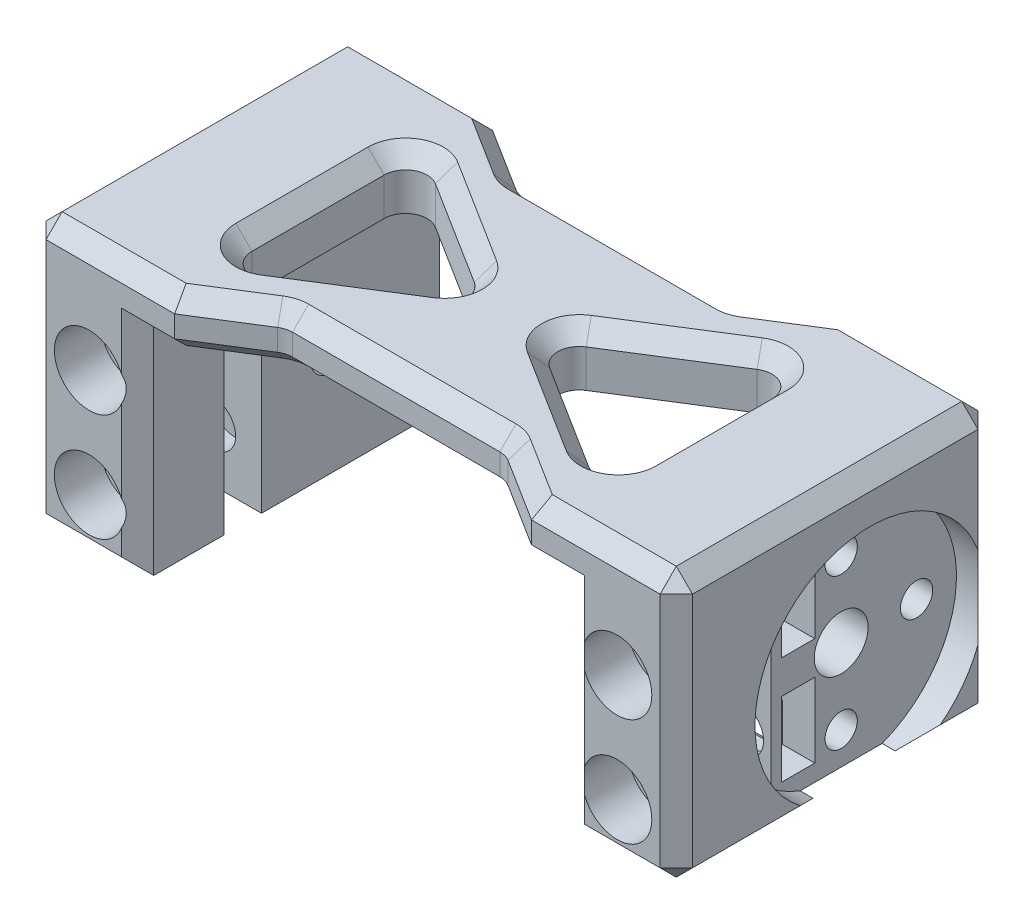
from build123d import *

# Parameters (mm, degrees)
SKETCH1_W           = 10
SKETCH1_H           = 20
SKETCH1_R           = 2.1
BOSS_EXTRUDE1_DEPTH = 8
BOSS_EXTRUDE2_DEPTH = 3.5
BOSS_EXTRUDE3_DEPTH = 18
SKETCH7_R           = 1.5
SKETCH7_R_2         = 2.5
CUT_EXTRUDE1_DEPTH  = 10
SKETCH8_W           = 3.1
SKETCH8_H           = 6.9
CUT_EXTRUDE3_DEPTH  = 13
CUT_EXTRUDE4_START  = -10
SKETCH13_R          = 3.225
CUT_EXTRUDE4_DEPTH  = 4.3
SKETCH14_R          = 4
BOSS_EXTRUDE4_DEPTH = 5
SKETCH15_R          = 6
BOSS_EXTRUDE5_DEPTH = 1
SKETCH16_R          = 3.225
CUT_EXTRUDE5_DEPTH  = 4.3
SKETCH18_R          = 1.95
CUT_EXTRUDE7_DEPTH  = 15
SKETCH19_R          = 2.1
CUT_EXTRUDE8_DEPTH  = 2
SKETCH20_R          = 10.7
CUT_EXTRUDE9_DEPTH  = 2.7
CUT_EXTRUDE10_DEPTH = 53.156015952


with BuildPart() as part:
    # Sketch1 → Boss-Extrude1 (new body)
    # profile 1 of 3: a face of its own
    with BuildSketch(Plane.XY):
        with Locations((25, 0)):
            Rectangle(SKETCH1_W, SKETCH1_H)
        with Locations((24.5, -5)):
            Circle(SKETCH1_R, mode=Mode.SUBTRACT)
        with Locations((24.5, 5)):
            Circle(SKETCH1_R, mode=Mode.SUBTRACT)
    # profile 2 of 3: a face of its own
    with BuildSketch(Plane.XY):
        Polygon((20, 10), (30, 10), (30, 15), (-30, 15), (-30, 10), (-20, 10), align=None)
    # profile 3 of 3: a face of its own
    with BuildSketch(Plane.XY):
        with Locations((-25, 0)):
            Rectangle(SKETCH1_W, SKETCH1_H)
        with Locations((-24.5, -5)):
            Circle(SKETCH1_R, mode=Mode.SUBTRACT)
        with Locations((-24.5, 5)):
            Circle(SKETCH1_R, mode=Mode.SUBTRACT)
    extrude(amount=-BOSS_EXTRUDE1_DEPTH)

    # Sketch5 → Boss-Extrude2 (add)
    with BuildSketch(Plane(origin=(0, 0, -8), x_dir=(-1, 0, 0), z_dir=(0, 0, -1))):
        Polygon((27.75, -10), (27.75, 10), (-27.75, 10), (-27.75, -10), (-30, -10), (-30, 15), (30, 15), (30, -10), align=None)
    extrude(amount=BOSS_EXTRUDE2_DEPTH)

    # Sketch6 → Boss-Extrude3 (add)
    with BuildSketch(Plane(origin=(0, 0, -11.5), x_dir=(-1, 0, 0), z_dir=(0, 0, -1))):
        Polygon((-27.75, -10), (-20, -10), (-20, 10), (20, 10), (20, -10), (27.75, -10), (30, -10), (30, 15), (-30, 15), (-30, -10), align=None)
    extrude(amount=BOSS_EXTRUDE3_DEPTH)

    # Sketch7 → Cut-Extrude1 (cut)
    with BuildSketch(Plane(origin=(30, 0, 0), x_dir=(0, 0, -1), z_dir=(1, 0, 0))):
        with Locations((25, 0)):
            Circle(SKETCH7_R)
        with Locations((18, 7)):
            Circle(SKETCH7_R)
        with Locations((18, -7)):
            Circle(SKETCH7_R)
        with Locations((18, 0)):
            Circle(SKETCH7_R_2)
    extrude(amount=-CUT_EXTRUDE1_DEPTH, mode=Mode.SUBTRACT)

    # Sketch8 → Cut-Extrude3 (cut)
    with BuildSketch(Plane(origin=(30, 0, 0), x_dir=(0, 0, -1), z_dir=(1, 0, 0))):
        with Locations((14, 5)):
            Rectangle(SKETCH8_W, SKETCH8_H)
        with Locations((14, -5)):
            Rectangle(SKETCH8_W, SKETCH8_H)
    extrude(amount=-CUT_EXTRUDE3_DEPTH, mode=Mode.SUBTRACT)

    # Sketch13 → Cut-Extrude4 (cut)
    with BuildSketch(Plane(origin=(30, 0, 0), x_dir=(0, 0, -1), z_dir=(1, 0, 0)).offset(CUT_EXTRUDE4_START)):
        with Locations((18, 7)):
            Circle(SKETCH13_R)
        with Locations(Location((25, 0, 0), (0, 0, 180))):
            Circle(SKETCH13_R)
        with Locations((18, -7)):
            Circle(SKETCH13_R)
    extrude(amount=CUT_EXTRUDE4_DEPTH, mode=Mode.SUBTRACT)

    # Sketch14 → Boss-Extrude4 (add)
    with BuildSketch(Plane.ZY.offset(30)):
        with Locations(Location((-18, 0, 0), (0, 0, 180))):
            Circle(SKETCH14_R)
    extrude(amount=BOSS_EXTRUDE4_DEPTH)

    # Sketch15 → Boss-Extrude5 (add)
    with BuildSketch(Plane.ZY.offset(30)):
        with Locations(Location((-18, 0, 0), (0, 0, 180))):
            Circle(SKETCH15_R)
    extrude(amount=BOSS_EXTRUDE5_DEPTH)

    # Sketch16 → Cut-Extrude5 (cut)
    with BuildSketch(Plane.XY):
        with Locations((-24.5, 5)):
            Circle(SKETCH16_R)
        with Locations((24.5, 5)):
            Circle(SKETCH16_R)
        with Locations((24.5, -5)):
            Circle(SKETCH16_R)
        with Locations((-24.5, -5)):
            Circle(SKETCH16_R)
    extrude(amount=-CUT_EXTRUDE5_DEPTH, mode=Mode.SUBTRACT)

    # Sketch18 → Cut-Extrude7 (cut)
    with BuildSketch(Plane.ZY.offset(35)):
        with Locations((-18, 0)):
            Circle(SKETCH18_R)
    extrude(amount=-CUT_EXTRUDE7_DEPTH, mode=Mode.SUBTRACT)

    # Sketch19 → Cut-Extrude8 (cut)
    with BuildSketch(Plane.XY.offset(-11.5)):
        with Locations((24.5, 5)):
            Circle(SKETCH19_R)
        with Locations((24.5, -5)):
            Circle(SKETCH19_R)
        with Locations((-24.5, -5)):
            Circle(SKETCH19_R)
        with Locations((-24.5, 5)):
            Circle(SKETCH19_R)
    extrude(amount=-CUT_EXTRUDE8_DEPTH, mode=Mode.SUBTRACT)

    # Sketch20 → Cut-Extrude9 (cut)
    with BuildSketch(Plane(origin=(30, 0, 0), x_dir=(0, 0, -1), z_dir=(1, 0, 0))):
        with Locations((18, 0)):
            Circle(SKETCH20_R)
    extrude(amount=-CUT_EXTRUDE9_DEPTH, mode=Mode.SUBTRACT)

    # Sketch21 → Cut-Extrude10 (cut, through all)
    with BuildSketch(Plane(origin=(0, 15, 0), x_dir=(1, 0, 0), z_dir=(0, 1, 0))):
        with BuildLine():
            Line((9.622484047, 25.5), (-9.622484047, 25.5))
            ThreePointArc((-9.622484047, 25.5), (-10.176630683, 25.578302442), (-10.687386285, 25.807078494))
            Line((-10.687386285, 25.807078494), (-16.558184576, 29.5))
            Line((-16.558184576, 29.5), (16.558184576, 29.5))
            Line((16.558184576, 29.5), (10.687386285, 25.807078494))
            ThreePointArc((10.687386285, 25.807078494), (10.176630683, 25.578302442), (9.622484047, 25.5))
        make_face()
        with BuildLine():
            Line((-5.191311112, 16.442921506), (-14.935097763, 22.572077625))
            ThreePointArc((-14.935097763, 22.572077625), (-16.967004531, 22.629842338), (-18, 20.879156119))
            Line((-18, 20.879156119), (-18, 8.620843881))
            ThreePointArc((-18, 8.620843881), (-16.967004531, 6.870157662), (-14.935097763, 6.927922375))
            Line((-14.935097763, 6.927922375), (-5.191311112, 13.057078494))
            ThreePointArc((-5.191311112, 13.057078494), (-4.256213349, 14.75), (-5.191311112, 16.442921506))
        make_face()
        with BuildLine():
            Line((-10.687386285, 3.692921506), (-16.558184576, 0))
            Line((-16.558184576, 0), (16.558184576, 0))
            Line((16.558184576, 0), (10.687386285, 3.692921506))
            ThreePointArc((10.687386285, 3.692921506), (10.176630683, 3.921697558), (9.622484047, 4))
            Line((9.622484047, 4), (-9.622484047, 4))
            ThreePointArc((-9.622484047, 4), (-10.176630683, 3.921697558), (-10.687386285, 3.692921506))
        make_face()
        with BuildLine():
            Line((14.935097763, 6.927922375), (5.191311112, 13.057078494))
            ThreePointArc((5.191311112, 13.057078494), (4.256213349, 14.75), (5.191311112, 16.442921506))
            Line((5.191311112, 16.442921506), (14.935097763, 22.572077625))
            ThreePointArc((14.935097763, 22.572077625), (16.967004531, 22.629842338), (18, 20.879156119))
            Line((18, 20.879156119), (18, 8.620843881))
            ThreePointArc((18, 8.620843881), (16.967004531, 6.870157662), (14.935097763, 6.927922375))
        make_face()
    extrude(amount=-CUT_EXTRUDE10_DEPTH, mode=Mode.SUBTRACT)

    # Chamfer1
    # the kernel refuses this chamfer: 1.5 mm, written as the material it takes off along each edge
    with BuildSketch(Plane(origin=(-29, -9, -1), x_dir=(0.7071067811865483, -0.7071067811865467, 0), z_dir=(-0.5773502691896244, -0.5773502691896257, 0.5773502691896271)), Plane(origin=(-29, 14, -1), x_dir=(0.7071067811865483, 0, 0.7071067811865467), z_dir=(-0.5773502691896253, 0.5773502691896253, 0.5773502691896266)), Plane(origin=(-29, 14, -28.5), x_dir=(0.7071067811865476, 0.7071067811865476, 0), z_dir=(-0.5773502691896257, 0.5773502691896257, -0.5773502691896257)), Plane(origin=(29, 14, -28.5), x_dir=(0, 0.7071067811865476, 0.7071067811865476), z_dir=(0.5773502691896253, 0.577350269189626, -0.577350269189626))) as chamfer1_piece_1:
        Polygon((-1.060660172, -0.612372436), (1.060660172, -0.612372436), (0, 1.224744871), align=None)
    extrude(amount=1.905255888, mode=Mode.SUBTRACT)
    with BuildSketch(Plane(origin=(29, -9, -1), x_dir=(0, 0.7071067811865476, 0.7071067811865476), z_dir=(0.5773502691896257, -0.5773502691896257, 0.5773502691896257)), Plane(origin=(29, 14, -1), x_dir=(0, 0.7071067811865476, -0.7071067811865476), z_dir=(0.5773502691896253, 0.577350269189626, 0.577350269189626)), Plane(origin=(-29, -9, -28.5), x_dir=(0.7071067811865483, -0.7071067811865467, 0), z_dir=(-0.5773502691896246, -0.5773502691896261, -0.5773502691896267)), Plane(origin=(29, -9, -28.5), x_dir=(0, -0.707106781186548, 0.7071067811865471), z_dir=(0.5773502691896255, -0.5773502691896255, -0.5773502691896263))) as chamfer1_piece_2:
        Polygon((-1.060660172, 0.612372436), (1.060660172, 0.612372436), (0, -1.224744871), align=None)
    extrude(amount=1.905255888, mode=Mode.SUBTRACT)
    with BuildSketch(Plane(origin=(20, 10, 0), x_dir=(0, -0.027495876610586778, -0.9996219169112968), z_dir=(-1, 0, 0)), Plane(origin=(-12.700660094, 10, 0), x_dir=(0, -0.027495876610586778, -0.9996219169112968), z_dir=(-1, 0, 0))) as chamfer1_piece_3:
        with BuildLine():
            Line((1.543009793, 0), (-0.084820732, -1.54067669))
            Line((-0.084820732, -1.54067669), (-0.11480939, -1.539851814))
            ThreePointArc((-0.11480939, -1.539851814), (-0.051193841, -0.770096744), (-0.029988658, 0.000824876))
            Line((-0.029988658, 0.000824876), (0.000824876, 0.029988658))
            ThreePointArc((0.000824876, 0.029988658), (0.771746497, 0.008783474), (1.543834669, 0.029988658))
            Line((1.543834669, 0.029988658), (1.543009793, 0))
        make_face()
    extrude(amount=7.299339906, mode=Mode.SUBTRACT)
    with BuildSketch(Plane(origin=(-20, -13.857524482, 0), x_dir=(0.027495876610586778, 0, -0.9996219169112968), z_dir=(0, 1, 0)), Plane(origin=(20, 10, 0), x_dir=(-0.027495876610586778, 0, -0.9996219169112968), z_dir=(0, -1, 0)), Plane(origin=(20, -13.857524482, -29.5), x_dir=(-0.027495876610586768, 0, 0.9996219169112968), z_dir=(0, 1, 0))) as chamfer1_piece_4:
        with BuildLine():
            Line((1.543009793, 0), (-0.084820732, 1.54067669))
            Line((-0.084820732, 1.54067669), (-0.11480939, 1.539851814))
            ThreePointArc((-0.11480939, 1.539851814), (-0.051193841, 0.770096744), (-0.029988658, -0.000824876))
            Line((-0.029988658, -0.000824876), (0.000824876, -0.029988658))
            ThreePointArc((0.000824876, -0.029988658), (0.771746497, -0.008783474), (1.543834669, -0.029988658))
            Line((1.543834669, -0.029988658), (1.543009793, 0))
        make_face()
    extrude(amount=23.857524482, mode=Mode.SUBTRACT)
    with BuildSketch(Plane(origin=(-33.857524482, -10, 0), x_dir=(0, 0.9996219169112968, 0.02749587661058636), z_dir=(1, 0, 0)), Plane(origin=(16.142475518, -10, -29.5), x_dir=(0, -0.027495876610586768, 0.9996219169112968), z_dir=(1, 0, 0))) as chamfer1_piece_5:
        with BuildLine():
            Line((1.543009793, 0), (-0.084820732, -1.54067669))
            Line((-0.084820732, -1.54067669), (-0.11480939, -1.539851814))
            ThreePointArc((-0.11480939, -1.539851814), (-0.051193841, -0.770096744), (-0.029988658, 0.000824876))
            Line((-0.029988658, 0.000824876), (0.000824876, 0.029988658))
            ThreePointArc((0.000824876, 0.029988658), (0.771746497, 0.008783474), (1.543834669, 0.029988658))
            Line((1.543834669, 0.029988658), (1.543009793, 0))
        make_face()
    extrude(amount=17.715048964, mode=Mode.SUBTRACT)
    with BuildSketch(Plane(origin=(-30, 18.857524482, 0), x_dir=(0.9996219169112968, 0, 0.027495876610586327), z_dir=(0, -1, 0)), Plane(origin=(30, -13.857524482, 0), x_dir=(-0.9996219169112968, 0, 0.02749587661058636), z_dir=(0, 1, 0)), Plane(origin=(-30, -13.857524482, -29.5), x_dir=(0.9996219169112965, 0, -0.02749587661058676), z_dir=(0, 1, 0)), Plane(origin=(30, 18.857524482, -29.5), x_dir=(-0.9996219169112965, 0, -0.02749587661058676), z_dir=(0, -1, 0))) as chamfer1_piece_6:
        with BuildLine():
            Line((1.543009793, 0), (-0.084820732, -1.54067669))
            Line((-0.084820732, -1.54067669), (-0.11480939, -1.539851814))
            ThreePointArc((-0.11480939, -1.539851814), (-0.051193841, -0.770096744), (-0.029988658, 0.000824876))
            Line((-0.029988658, 0.000824876), (0.000824876, 0.029988658))
            ThreePointArc((0.000824876, 0.029988658), (0.771746497, 0.008783474), (1.543834669, 0.029988658))
            Line((1.543834669, 0.029988658), (1.543009793, 0))
        make_face()
    extrude(amount=32.715048964, mode=Mode.SUBTRACT)
    with BuildSketch(Plane(origin=(-12.700660094, 15, 0), x_dir=(0, -0.9996219169112968, 0.02749587661058636), z_dir=(-1, 0, 0)), Plane(origin=(12.700660094, 15, -29.5), x_dir=(0, -0.9996219169112965, -0.02749587661058676), z_dir=(1, 0, 0)), Plane(origin=(33.857524482, 15, 0), x_dir=(0, -0.9996219169112968, 0.02749587661058636), z_dir=(-1, 0, 0)), Plane(origin=(-33.857524482, 15, -29.5), x_dir=(0, -0.9996219169112965, -0.02749587661058676), z_dir=(1, 0, 0))) as chamfer1_piece_7:
        with BuildLine():
            Line((1.543009793, 0), (-0.084820732, -1.54067669))
            Line((-0.084820732, -1.54067669), (-0.11480939, -1.539851814))
            ThreePointArc((-0.11480939, -1.539851814), (-0.051193841, -0.770096744), (-0.029988658, 0.000824876))
            Line((-0.029988658, 0.000824876), (0.000824876, 0.029988658))
            ThreePointArc((0.000824876, 0.029988658), (0.771746497, 0.008783474), (1.543834669, 0.029988658))
            Line((1.543834669, 0.029988658), (1.543009793, 0))
        make_face()
    extrude(amount=21.156864388, mode=Mode.SUBTRACT)
    with BuildSketch(Plane(origin=(16.142475518, -10, 0), x_dir=(0, -0.027495876610586778, -0.9996219169112968), z_dir=(1, 0, 0)), Plane(origin=(-33.857524482, -10, -29.5), x_dir=(0, 0.9996219169112965, -0.02749587661058676), z_dir=(1, 0, 0))) as chamfer1_piece_8:
        with BuildLine():
            Line((1.543009793, 0), (-0.084820732, 1.54067669))
            Line((-0.084820732, 1.54067669), (-0.11480939, 1.539851814))
            ThreePointArc((-0.11480939, 1.539851814), (-0.051193841, 0.770096744), (-0.029988658, -0.000824876))
            Line((-0.029988658, -0.000824876), (0.000824876, -0.029988658))
            ThreePointArc((0.000824876, -0.029988658), (0.771746497, -0.008783474), (1.543834669, -0.029988658))
            Line((1.543834669, -0.029988658), (1.543009793, 0))
        make_face()
    extrude(amount=17.715048964, mode=Mode.SUBTRACT)
    with BuildSketch(Plane(origin=(-30, -10, -33.357524482), x_dir=(-0.027495876610586768, 0.9996219169112968, 0), z_dir=(0, 0, 1)), Plane(origin=(-30, 15, -33.357524482), x_dir=(0.9996219169112965, 0.02749587661058676, 0), z_dir=(0, 0, 1)), Plane(origin=(30, 15, -33.357524482), x_dir=(0.027495876610586768, -0.9996219169112968, 0), z_dir=(0, 0, 1))) as chamfer1_piece_9:
        with BuildLine():
            Line((1.543009793, 0), (-0.084820732, -1.54067669))
            Line((-0.084820732, -1.54067669), (-0.11480939, -1.539851814))
            ThreePointArc((-0.11480939, -1.539851814), (-0.051193841, -0.770096744), (-0.029988658, 0.000824876))
            Line((-0.029988658, 0.000824876), (0.000824876, 0.029988658))
            ThreePointArc((0.000824876, 0.029988658), (0.771746497, 0.008783474), (1.543834669, 0.029988658))
            Line((1.543834669, 0.029988658), (1.543009793, 0))
        make_face()
    extrude(amount=37.215048964, mode=Mode.SUBTRACT)
    with BuildSketch(Plane(origin=(30, -10, -33.357524482), x_dir=(-0.9996219169112965, -0.02749587661058676, 0), z_dir=(0, 0, 1))) as chamfer1_piece_10:
        with BuildLine():
            Line((1.543009793, 0), (-0.084820732, -1.54067669))
            Line((-0.084820732, -1.54067669), (-0.11480939, -1.539851814))
            ThreePointArc((-0.11480939, -1.539851814), (-0.051193841, -0.770096744), (-0.029988658, 0.000824876))
            Line((-0.029988658, 0.000824876), (0.000824876, 0.029988658))
            ThreePointArc((0.000824876, 0.029988658), (0.771746497, 0.008783474), (1.543834669, 0.029988658))
            Line((1.543834669, 0.029988658), (1.543009793, 0))
        make_face()
    extrude(amount=15.408475702, mode=Mode.SUBTRACT)
    with BuildSketch(Plane(origin=(30, -10, -18.05095122), x_dir=(-0.9996219169112965, -0.02749587661058676, 0), z_dir=(0, 0, 1))) as chamfer1_piece_11:
        with BuildLine():
            Line((1.543009793, 0), (-0.084820732, -1.54067669))
            Line((-0.084820732, -1.54067669), (-0.11480939, -1.539851814))
            ThreePointArc((-0.11480939, -1.539851814), (-0.051193841, -0.770096744), (-0.029988658, 0.000824876))
            Line((-0.029988658, 0.000824876), (0.000824876, 0.029988658))
            ThreePointArc((0.000824876, 0.029988658), (0.771746497, 0.008783474), (1.543834669, 0.029988658))
            Line((1.543834669, 0.029988658), (1.543009793, 0))
        make_face()
    extrude(amount=21.908475702, mode=Mode.SUBTRACT)
    with BuildSketch(Plane(origin=(-12.700660094, 10, -29.5), x_dir=(0, -0.027495876610586768, 0.9996219169112968), z_dir=(-1, 0, 0)), Plane(origin=(20, 10, -29.5), x_dir=(0, -0.027495876610583316, 0.9996219169112969), z_dir=(-1, 0, 0))) as chamfer1_piece_12:
        with BuildLine():
            Line((1.543009793, 0), (-0.084820732, 1.54067669))
            Line((-0.084820732, 1.54067669), (-0.11480939, 1.539851814))
            ThreePointArc((-0.11480939, 1.539851814), (-0.051193841, 0.770096744), (-0.029988658, -0.000824876))
            Line((-0.029988658, -0.000824876), (0.000824876, -0.029988658))
            ThreePointArc((0.000824876, -0.029988658), (0.771746497, -0.008783474), (1.543834669, -0.029988658))
            Line((1.543834669, -0.029988658), (1.543009793, 0))
        make_face()
    extrude(amount=7.299339906, mode=Mode.SUBTRACT)
    with BuildSketch(Plane(origin=(9.622484047, 10, -27.5), x_dir=(0, 0, 1), z_dir=(-1, 0, 0))) as chamfer1_piece_13:
        with BuildLine():
            Line((3.542426407, -0.042426407), (1.957573593, 1.542426407))
            Line((1.957573593, 1.542426407), (1.927573593, 1.542426407))
            ThreePointArc((1.927573593, 1.542426407), (1.97, 0.771213203), (1.97, 0))
            Line((1.97, 0), (2, -0.03))
            ThreePointArc((2, -0.03), (2.771213203, -0.03), (3.542426407, -0.072426407))
            Line((3.542426407, -0.072426407), (3.542426407, -0.042426407))
        make_face()
    revolve(axis=Axis((9.622484047, 10, -27.5), (0, 1, 0)), revolution_arc=32.171217129, mode=Mode.SUBTRACT)
    with BuildSketch(Plane(origin=(-9.622484047, 10, -25.5), x_dir=(0, -0.027495876610587916, 0.9996219169112968), z_dir=(1, 0, 0)), Plane(origin=(9.622484047, 15, -4), x_dir=(0, -0.9996219169112968, 0.02749587661058648), z_dir=(-1, 0, 0))) as chamfer1_piece_14:
        with BuildLine():
            Line((1.543009793, 0), (-0.084820732, -1.54067669))
            Line((-0.084820732, -1.54067669), (-0.11480939, -1.539851814))
            ThreePointArc((-0.11480939, -1.539851814), (-0.051193841, -0.770096744), (-0.029988658, 0.000824876))
            Line((-0.029988658, 0.000824876), (0.000824876, 0.029988658))
            ThreePointArc((0.000824876, 0.029988658), (0.771746497, 0.008783474), (1.543834669, 0.029988658))
            Line((1.543834669, 0.029988658), (1.543009793, 0))
        make_face()
    extrude(amount=19.244968094, mode=Mode.SUBTRACT)
    with BuildSketch(Plane(origin=(-9.622484047, 10, -27.5), x_dir=(-0.5324511187414508, 0, 0.8464607528710221), z_dir=(-0.8464607528710221, 0, -0.5324511187414508))) as chamfer1_piece_15:
        with BuildLine():
            Line((3.542426407, -0.042426407), (1.957573593, 1.542426407))
            Line((1.957573593, 1.542426407), (1.927573593, 1.542426407))
            ThreePointArc((1.927573593, 1.542426407), (1.97, 0.771213203), (1.97, 0))
            Line((1.97, 0), (2, -0.03))
            ThreePointArc((2, -0.03), (2.771213203, -0.03), (3.542426407, -0.072426407))
            Line((3.542426407, -0.072426407), (3.542426407, -0.042426407))
        make_face()
    revolve(axis=Axis((-9.622484047, 10, -27.5), (0, 1, 0)), revolution_arc=32.171217129, mode=Mode.SUBTRACT)
    with BuildSketch(Plane(origin=(10.687386285, 10, -25.807078494), x_dir=(0.5322498079778928, -0.02749587661058793, 0.8461407203751109), z_dir=(0.8464607528710225, 0, -0.53245111874145)), Plane(origin=(-19.823427653, 10, -31.553943226), x_dir=(-0.532249807977893, -0.027495876610586747, 0.8461407203751108), z_dir=(0.8464607528710224, 0, 0.5324511187414502)), Plane(origin=(19.823427653, 15, 2.053943226), x_dir=(-0.0146402102620835, -0.9996219169112968, 0.023274180416645526), z_dir=(-0.8464607528710224, 0, -0.5324511187414505)), Plane(origin=(-10.687386285, 15, -3.692921506), x_dir=(0.014640210262083493, -0.9996219169112968, 0.023274180416645536), z_dir=(-0.8464607528710225, 0, 0.53245111874145))) as chamfer1_piece_16:
        with BuildLine():
            Line((1.543009793, 0), (-0.084820732, -1.54067669))
            Line((-0.084820732, -1.54067669), (-0.11480939, -1.539851814))
            ThreePointArc((-0.11480939, -1.539851814), (-0.051193841, -0.770096744), (-0.029988658, 0.000824876))
            Line((-0.029988658, 0.000824876), (0.000824876, 0.029988658))
            ThreePointArc((0.000824876, 0.029988658), (0.771746497, 0.008783474), (1.543834669, 0.029988658))
            Line((1.543834669, 0.029988658), (1.543009793, 0))
        make_face()
    extrude(amount=10.793225011, mode=Mode.SUBTRACT)
    with BuildSketch(Plane(origin=(19.823427653, 15, -31.553943226), x_dir=(-0.014640210262083748, -0.9996219169112968, -0.023274180416645942), z_dir=(-0.8464607528710225, 0, 0.53245111874145)), Plane(origin=(-10.687386285, 15, -25.807078494), x_dir=(0.01464021026208337, -0.9996219169112968, -0.023274180416645328), z_dir=(-0.8464607528710224, 0, -0.5324511187414502)), Plane(origin=(-19.823427653, 10, 2.053943226), x_dir=(-0.5322498079778928, -0.027495876610586802, -0.846140720375111), z_dir=(0.8464607528710225, 0, -0.53245111874145)), Plane(origin=(10.687386285, 10, -3.692921506), x_dir=(0.532249807977893, -0.027495876610586747, -0.8461407203751107), z_dir=(0.8464607528710224, 0, 0.5324511187414505))) as chamfer1_piece_17:
        with BuildLine():
            Line((1.543009793, 0), (-0.084820732, 1.54067669))
            Line((-0.084820732, 1.54067669), (-0.11480939, 1.539851814))
            ThreePointArc((-0.11480939, 1.539851814), (-0.051193841, 0.770096744), (-0.029988658, -0.000824876))
            Line((-0.029988658, -0.000824876), (0.000824876, -0.029988658))
            ThreePointArc((0.000824876, -0.029988658), (0.771746497, -0.008783474), (1.543834669, -0.029988658))
            Line((1.543834669, -0.029988658), (1.543009793, 0))
        make_face()
    extrude(amount=10.793225011, mode=Mode.SUBTRACT)
    with BuildSketch(Plane(origin=(-9.622484047, 15, -27.5), x_dir=(0, 0, 1), z_dir=(1, 0, 0))) as chamfer1_piece_18:
        with BuildLine():
            Line((1.957573593, 1.542426407), (3.542426407, -0.042426407))
            Line((3.542426407, -0.042426407), (3.542426407, -0.072426407))
            ThreePointArc((3.542426407, -0.072426407), (2.771213203, -0.03), (2, -0.03))
            Line((2, -0.03), (1.97, 0))
            ThreePointArc((1.97, 0), (1.97, 0.771213203), (1.927573593, 1.542426407))
            Line((1.927573593, 1.542426407), (1.957573593, 1.542426407))
        make_face()
    revolve(axis=Axis((-9.622484047, 15, -27.5), (0, -1, 0)), revolution_arc=32.171217129, mode=Mode.SUBTRACT)
    with BuildSketch(Plane(origin=(9.622484047, 15, -25.5), x_dir=(0, -0.9996219169112965, -0.02749587661058676), z_dir=(-1, 0, 0)), Plane(origin=(-9.622484047, 10, -4), x_dir=(0, -0.027495876610587933, -0.9996219169112968), z_dir=(1, 0, 0))) as chamfer1_piece_19:
        with BuildLine():
            Line((1.543009793, 0), (-0.084820732, 1.54067669))
            Line((-0.084820732, 1.54067669), (-0.11480939, 1.539851814))
            ThreePointArc((-0.11480939, 1.539851814), (-0.051193841, 0.770096744), (-0.029988658, -0.000824876))
            Line((-0.029988658, -0.000824876), (0.000824876, -0.029988658))
            ThreePointArc((0.000824876, -0.029988658), (0.771746497, -0.008783474), (1.543834669, -0.029988658))
            Line((1.543834669, -0.029988658), (1.543009793, 0))
        make_face()
    extrude(amount=19.244968094, mode=Mode.SUBTRACT)
    with BuildSketch(Plane(origin=(9.622484047, 15, -27.5), x_dir=(0.5324511187414572, 0, 0.846460752871018), z_dir=(0.846460752871018, 0, -0.5324511187414572))) as chamfer1_piece_20:
        with BuildLine():
            Line((1.957573593, 1.542426407), (3.542426407, -0.042426407))
            Line((3.542426407, -0.042426407), (3.542426407, -0.072426407))
            ThreePointArc((3.542426407, -0.072426407), (2.771213203, -0.03), (2, -0.03))
            Line((2, -0.03), (1.97, 0))
            ThreePointArc((1.97, 0), (1.97, 0.771213203), (1.927573593, 1.542426407))
            Line((1.927573593, 1.542426407), (1.957573593, 1.542426407))
        make_face()
    revolve(axis=Axis((9.622484047, 15, -27.5), (0, -1, 0)), revolution_arc=32.171217129, mode=Mode.SUBTRACT)
    with BuildSketch(Plane(origin=(-6.256213349, 15, -14.75), x_dir=(0.5324511187414395, 0, 0.8464607528710294), z_dir=(-0.8464607528710294, 0, 0.5324511187414395))) as chamfer1_piece_21:
        with BuildLine():
            Line((1.957573593, -1.542426407), (3.542426407, 0.042426407))
            Line((3.542426407, 0.042426407), (3.542426407, 0.072426407))
            ThreePointArc((3.542426407, 0.072426407), (2.771213203, 0.03), (2, 0.03))
            Line((2, 0.03), (1.97, 0))
            ThreePointArc((1.97, 0), (1.97, -0.771213203), (1.927573593, -1.542426407))
            Line((1.927573593, -1.542426407), (1.957573593, -1.542426407))
        make_face()
    revolve(axis=Axis((-6.256213349, 15, -14.75), (0, 1, 0)), revolution_arc=115.657565743, mode=Mode.SUBTRACT)
    with BuildSketch(Plane(origin=(-5.191311112, 15, -16.442921506), x_dir=(-0.014640210262083347, -0.9996219169112968, 0.023274180416645338), z_dir=(-0.846460752871023, 0, -0.5324511187414495)), Plane(origin=(-14.935097763, 15, -6.927922375), x_dir=(-0.01464021026208362, -0.9996219169112968, -0.023274180416645744), z_dir=(0.8464607528710225, 0, -0.5324511187414499))) as chamfer1_piece_22:
        with BuildLine():
            Line((1.543009793, 0), (-0.084820732, -1.54067669))
            Line((-0.084820732, -1.54067669), (-0.11480939, -1.539851814))
            ThreePointArc((-0.11480939, -1.539851814), (-0.051193841, -0.770096744), (-0.029988658, 0.000824876))
            Line((-0.029988658, 0.000824876), (0.000824876, 0.029988658))
            ThreePointArc((0.000824876, 0.029988658), (0.771746497, 0.008783474), (1.543834669, 0.029988658))
            Line((1.543834669, 0.029988658), (1.543009793, 0))
        make_face()
    extrude(amount=11.511209017, mode=Mode.SUBTRACT)
    with BuildSketch(Plane(origin=(-16, 15, -20.879156119), x_dir=(0.5324511187414603, 0, -0.8464607528710162), z_dir=(0.8464607528710162, 0, 0.5324511187414603))) as chamfer1_piece_23:
        with BuildLine():
            Line((1.957573593, -1.542426407), (3.542426407, 0.042426407))
            Line((3.542426407, 0.042426407), (3.542426407, 0.072426407))
            ThreePointArc((3.542426407, 0.072426407), (2.771213203, 0.03), (2, 0.03))
            Line((2, 0.03), (1.97, 0))
            ThreePointArc((1.97, 0), (1.97, -0.771213203), (1.927573593, -1.542426407))
            Line((1.927573593, -1.542426407), (1.957573593, -1.542426407))
        make_face()
    revolve(axis=Axis((-16, 15, -20.879156119), (0, 1, 0)), revolution_arc=122.171217129, mode=Mode.SUBTRACT)
    with BuildSketch(Plane(origin=(-18, 15, -20.879156119), x_dir=(0.027495876610586768, -0.9996219169112968, 0), z_dir=(0, 0, 1))) as chamfer1_piece_24:
        with BuildLine():
            Line((1.543009793, 0), (-0.084820732, -1.54067669))
            Line((-0.084820732, -1.54067669), (-0.11480939, -1.539851814))
            ThreePointArc((-0.11480939, -1.539851814), (-0.051193841, -0.770096744), (-0.029988658, 0.000824876))
            Line((-0.029988658, 0.000824876), (0.000824876, 0.029988658))
            ThreePointArc((0.000824876, 0.029988658), (0.771746497, 0.008783474), (1.543834669, 0.029988658))
            Line((1.543834669, 0.029988658), (1.543009793, 0))
        make_face()
    extrude(amount=12.258312238, mode=Mode.SUBTRACT)
    with BuildSketch(Plane(origin=(-16, 15, -8.620843881), x_dir=(-1, 0, 0), z_dir=(0, 0, -1))) as chamfer1_piece_25:
        with BuildLine():
            Line((1.957573593, -1.542426407), (3.542426407, 0.042426407))
            Line((3.542426407, 0.042426407), (3.542426407, 0.072426407))
            ThreePointArc((3.542426407, 0.072426407), (2.771213203, 0.03), (2, 0.03))
            Line((2, 0.03), (1.97, 0))
            ThreePointArc((1.97, 0), (1.97, -0.771213203), (1.927573593, -1.542426407))
            Line((1.927573593, -1.542426407), (1.957573593, -1.542426407))
        make_face()
    revolve(axis=Axis((-16, 15, -8.620843881), (0, 1, 0)), revolution_arc=122.171217129, mode=Mode.SUBTRACT)
    with BuildSketch(Plane(origin=(16, 15, -8.620843881), x_dir=(1, 0, 0), z_dir=(0, 0, -1))) as chamfer1_piece_26:
        with BuildLine():
            Line((1.957573593, 1.542426407), (3.542426407, -0.042426407))
            Line((3.542426407, -0.042426407), (3.542426407, -0.072426407))
            ThreePointArc((3.542426407, -0.072426407), (2.771213203, -0.03), (2, -0.03))
            Line((2, -0.03), (1.97, 0))
            ThreePointArc((1.97, 0), (1.97, 0.771213203), (1.927573593, 1.542426407))
            Line((1.927573593, 1.542426407), (1.957573593, 1.542426407))
        make_face()
    revolve(axis=Axis((16, 15, -8.620843881), (0, -1, 0)), revolution_arc=122.171217129, mode=Mode.SUBTRACT)
    with BuildSketch(Plane(origin=(18, 15, -20.879156119), x_dir=(-0.027495876610586768, -0.9996219169112968, 0), z_dir=(0, 0, 1))) as chamfer1_piece_27:
        with BuildLine():
            Line((1.543009793, 0), (-0.084820732, 1.54067669))
            Line((-0.084820732, 1.54067669), (-0.11480939, 1.539851814))
            ThreePointArc((-0.11480939, 1.539851814), (-0.051193841, 0.770096744), (-0.029988658, -0.000824876))
            Line((-0.029988658, -0.000824876), (0.000824876, -0.029988658))
            ThreePointArc((0.000824876, -0.029988658), (0.771746497, -0.008783474), (1.543834669, -0.029988658))
            Line((1.543834669, -0.029988658), (1.543009793, 0))
        make_face()
    extrude(amount=12.258312238, mode=Mode.SUBTRACT)
    with BuildSketch(Plane(origin=(16, 15, -20.879156119), x_dir=(-0.5324511187414646, 0, -0.8464607528710134), z_dir=(-0.8464607528710134, 0, 0.5324511187414646))) as chamfer1_piece_28:
        with BuildLine():
            Line((1.957573593, 1.542426407), (3.542426407, -0.042426407))
            Line((3.542426407, -0.042426407), (3.542426407, -0.072426407))
            ThreePointArc((3.542426407, -0.072426407), (2.771213203, -0.03), (2, -0.03))
            Line((2, -0.03), (1.97, 0))
            ThreePointArc((1.97, 0), (1.97, 0.771213203), (1.927573593, 1.542426407))
            Line((1.927573593, 1.542426407), (1.957573593, 1.542426407))
        make_face()
    revolve(axis=Axis((16, 15, -20.879156119), (0, -1, 0)), revolution_arc=122.171217129, mode=Mode.SUBTRACT)
    with BuildSketch(Plane(origin=(5.191311112, 15, -16.442921506), x_dir=(0.01464021026208334, -0.9996219169112968, 0.023274180416645345), z_dir=(0.8464607528710232, 0, -0.5324511187414492)), Plane(origin=(14.935097763, 15, -6.927922375), x_dir=(0.014640210262083628, -0.9996219169112968, -0.02327418041664574), z_dir=(-0.8464607528710224, 0, -0.5324511187414502))) as chamfer1_piece_29:
        with BuildLine():
            Line((1.543009793, 0), (-0.084820732, 1.54067669))
            Line((-0.084820732, 1.54067669), (-0.11480939, 1.539851814))
            ThreePointArc((-0.11480939, 1.539851814), (-0.051193841, 0.770096744), (-0.029988658, -0.000824876))
            Line((-0.029988658, -0.000824876), (0.000824876, -0.029988658))
            ThreePointArc((0.000824876, -0.029988658), (0.771746497, -0.008783474), (1.543834669, -0.029988658))
            Line((1.543834669, -0.029988658), (1.543009793, 0))
        make_face()
    extrude(amount=11.511209017, mode=Mode.SUBTRACT)
    with BuildSketch(Plane(origin=(6.256213349, 15, -14.75), x_dir=(-0.5324511187414405, 0, 0.8464607528710287), z_dir=(0.8464607528710287, 0, 0.5324511187414405))) as chamfer1_piece_30:
        with BuildLine():
            Line((1.957573593, 1.542426407), (3.542426407, -0.042426407))
            Line((3.542426407, -0.042426407), (3.542426407, -0.072426407))
            ThreePointArc((3.542426407, -0.072426407), (2.771213203, -0.03), (2, -0.03))
            Line((2, -0.03), (1.97, 0))
            ThreePointArc((1.97, 0), (1.97, 0.771213203), (1.927573593, 1.542426407))
            Line((1.927573593, 1.542426407), (1.957573593, 1.542426407))
        make_face()
    revolve(axis=Axis((6.256213349, 15, -14.75), (0, -1, 0)), revolution_arc=115.657565743, mode=Mode.SUBTRACT)
    with BuildSketch(Plane(origin=(-9.622484047, 10, -2), x_dir=(0, 0, -1), z_dir=(1, 0, 0))) as chamfer1_piece_31:
        with BuildLine():
            Line((3.542426407, -0.042426407), (1.957573593, 1.542426407))
            Line((1.957573593, 1.542426407), (1.927573593, 1.542426407))
            ThreePointArc((1.927573593, 1.542426407), (1.97, 0.771213203), (1.97, 0))
            Line((1.97, 0), (2, -0.03))
            ThreePointArc((2, -0.03), (2.771213203, -0.03), (3.542426407, -0.072426407))
            Line((3.542426407, -0.072426407), (3.542426407, -0.042426407))
        make_face()
    revolve(axis=Axis((-9.622484047, 10, -2), (0, 1, 0)), revolution_arc=32.171217129, mode=Mode.SUBTRACT)
    with BuildSketch(Plane(origin=(9.622484047, 10, -2), x_dir=(0.5324511187414538, 0, -0.8464607528710202), z_dir=(0.8464607528710202, 0, 0.5324511187414538))) as chamfer1_piece_32:
        with BuildLine():
            Line((3.542426407, -0.042426407), (1.957573593, 1.542426407))
            Line((1.957573593, 1.542426407), (1.927573593, 1.542426407))
            ThreePointArc((1.927573593, 1.542426407), (1.97, 0.771213203), (1.97, 0))
            Line((1.97, 0), (2, -0.03))
            ThreePointArc((2, -0.03), (2.771213203, -0.03), (3.542426407, -0.072426407))
            Line((3.542426407, -0.072426407), (3.542426407, -0.042426407))
        make_face()
    revolve(axis=Axis((9.622484047, 10, -2), (0, 1, 0)), revolution_arc=32.171217129, mode=Mode.SUBTRACT)
    with BuildSketch(Plane(origin=(9.622484047, 15, -2), x_dir=(0.5324511187414538, 0, -0.8464607528710202), z_dir=(0.8464607528710202, 0, 0.5324511187414538))) as chamfer1_piece_33:
        with BuildLine():
            Line((1.957573593, -1.542426407), (3.542426407, 0.042426407))
            Line((3.542426407, 0.042426407), (3.542426407, 0.072426407))
            ThreePointArc((3.542426407, 0.072426407), (2.771213203, 0.03), (2, 0.03))
            Line((2, 0.03), (1.97, 0))
            ThreePointArc((1.97, 0), (1.97, -0.771213203), (1.927573593, -1.542426407))
            Line((1.927573593, -1.542426407), (1.957573593, -1.542426407))
        make_face()
    revolve(axis=Axis((9.622484047, 15, -2), (0, 1, 0)), revolution_arc=32.171217129, mode=Mode.SUBTRACT)
    with BuildSketch(Plane(origin=(-9.622484047, 15, -2), x_dir=(0, 0, -1), z_dir=(1, 0, 0))) as chamfer1_piece_34:
        with BuildLine():
            Line((1.957573593, -1.542426407), (3.542426407, 0.042426407))
            Line((3.542426407, 0.042426407), (3.542426407, 0.072426407))
            ThreePointArc((3.542426407, 0.072426407), (2.771213203, 0.03), (2, 0.03))
            Line((2, 0.03), (1.97, 0))
            ThreePointArc((1.97, 0), (1.97, -0.771213203), (1.927573593, -1.542426407))
            Line((1.927573593, -1.542426407), (1.957573593, -1.542426407))
        make_face()
    revolve(axis=Axis((-9.622484047, 15, -2), (0, 1, 0)), revolution_arc=32.171217129, mode=Mode.SUBTRACT)
    with BuildSketch(Plane(origin=(-20, 10, -29.5), x_dir=(-0.9996219169112965, 0, -0.02749587661058676), z_dir=(0, -1, 0))) as chamfer1_piece_35:
        with BuildLine():
            Line((1.543009793, 0), (-0.084820732, -1.54067669))
            Line((-0.084820732, -1.54067669), (-0.11480939, -1.539851814))
            ThreePointArc((-0.11480939, -1.539851814), (-0.051193841, -0.770096744), (-0.029988658, 0.000824876))
            Line((-0.029988658, 0.000824876), (0.000824876, 0.029988658))
            ThreePointArc((0.000824876, 0.029988658), (0.771746497, 0.008783474), (1.543834669, 0.029988658))
            Line((1.543834669, 0.029988658), (1.543009793, 0))
        make_face()
    extrude(amount=23.857524482, mode=Mode.SUBTRACT)
    with BuildSketch(Plane(origin=(20, 13.857524482, 0), x_dir=(-0.027495876610586778, 0, -0.9996219169112968), z_dir=(0, -1, 0))) as chamfer1_piece_36a_section:
        with BuildLine():
            Line((1.543009793, 0), (-0.084820732, 1.54067669))
            Line((-0.084820732, 1.54067669), (-0.11480939, 1.539851814))
            ThreePointArc((-0.11480939, 1.539851814), (-0.051193841, 0.770096744), (-0.029988658, -0.000824876))
            Line((-0.029988658, -0.000824876), (0.000824876, -0.029988658))
            ThreePointArc((0.000824876, -0.029988658), (0.771746497, -0.008783474), (1.543834669, -0.029988658))
            Line((1.543834669, -0.029988658), (1.543009793, 0))
        make_face()
    chamfer1_piece_36a = extrude(amount=27.715048964, mode=Mode.PRIVATE)
    chamfer1_piece_36a = split(chamfer1_piece_36a, bisect_by=Plane(origin=(20.49469044, 10, -0.49469044), z_dir=(0, 1, 0)), keep=Keep.TOP, mode=Mode.PRIVATE)
    with BuildSketch(Plane(origin=(23.857524482, 10, 0), x_dir=(0, -0.027495876610586778, -0.9996219169112968), z_dir=(-1, 0, 0))) as chamfer1_piece_36b_section:
        with BuildLine():
            Line((1.543009793, 0), (-0.084820732, -1.54067669))
            Line((-0.084820732, -1.54067669), (-0.11480939, -1.539851814))
            ThreePointArc((-0.11480939, -1.539851814), (-0.051193841, -0.770096744), (-0.029988658, 0.000824876))
            Line((-0.029988658, 0.000824876), (0.000824876, 0.029988658))
            ThreePointArc((0.000824876, 0.029988658), (0.771746497, 0.008783474), (1.543834669, 0.029988658))
            Line((1.543834669, 0.029988658), (1.543009793, 0))
        make_face()
    chamfer1_piece_36b = extrude(amount=11.156864388, mode=Mode.PRIVATE)
    chamfer1_piece_36b = split(chamfer1_piece_36b, bisect_by=Plane(origin=(20, 10.49469044, -0.49469044), z_dir=(1, 0, 0)), keep=Keep.TOP, mode=Mode.PRIVATE)
    chamfer1_piece_36 = chamfer1_piece_36a & chamfer1_piece_36b
    add(chamfer1_piece_36, mode=Mode.SUBTRACT)
    with BuildSketch(Plane(origin=(-12.700660094, 10, 0), x_dir=(0, -0.027495876610586778, -0.9996219169112968), z_dir=(-1, 0, 0))) as chamfer1_piece_37a_section:
        with BuildLine():
            Line((1.543009793, 0), (-0.084820732, -1.54067669))
            Line((-0.084820732, -1.54067669), (-0.11480939, -1.539851814))
            ThreePointArc((-0.11480939, -1.539851814), (-0.051193841, -0.770096744), (-0.029988658, 0.000824876))
            Line((-0.029988658, 0.000824876), (0.000824876, 0.029988658))
            ThreePointArc((0.000824876, 0.029988658), (0.771746497, 0.008783474), (1.543834669, 0.029988658))
            Line((1.543834669, 0.029988658), (1.543009793, 0))
        make_face()
    chamfer1_piece_37a = extrude(amount=11.156864388, mode=Mode.PRIVATE)
    chamfer1_piece_37a = split(chamfer1_piece_37a, bisect_by=Plane(origin=(-20, 10.49469044, -0.49469044), z_dir=(-1, 0, 0)), keep=Keep.TOP, mode=Mode.PRIVATE)
    with BuildSketch(Plane(origin=(-20, -13.857524482, 0), x_dir=(0.027495876610586778, 0, -0.9996219169112968), z_dir=(0, 1, 0))) as chamfer1_piece_37b_section:
        with BuildLine():
            Line((1.543009793, 0), (-0.084820732, 1.54067669))
            Line((-0.084820732, 1.54067669), (-0.11480939, 1.539851814))
            ThreePointArc((-0.11480939, 1.539851814), (-0.051193841, 0.770096744), (-0.029988658, -0.000824876))
            Line((-0.029988658, -0.000824876), (0.000824876, -0.029988658))
            ThreePointArc((0.000824876, -0.029988658), (0.771746497, -0.008783474), (1.543834669, -0.029988658))
            Line((1.543834669, -0.029988658), (1.543009793, 0))
        make_face()
    chamfer1_piece_37b = extrude(amount=27.715048964, mode=Mode.PRIVATE)
    chamfer1_piece_37b = split(chamfer1_piece_37b, bisect_by=Plane(origin=(-20.49469044, 10, -0.49469044), z_dir=(0, 1, 0)), keep=Keep.TOP, mode=Mode.PRIVATE)
    chamfer1_piece_37 = chamfer1_piece_37a & chamfer1_piece_37b
    add(chamfer1_piece_37, mode=Mode.SUBTRACT)
    with BuildSketch(Plane(origin=(-12.700660094, 10, -29.5), x_dir=(0, -0.027495876610586768, 0.9996219169112968), z_dir=(-1, 0, 0))) as chamfer1_piece_38a_section:
        with BuildLine():
            Line((1.543009793, 0), (-0.084820732, 1.54067669))
            Line((-0.084820732, 1.54067669), (-0.11480939, 1.539851814))
            ThreePointArc((-0.11480939, 1.539851814), (-0.051193841, 0.770096744), (-0.029988658, -0.000824876))
            Line((-0.029988658, -0.000824876), (0.000824876, -0.029988658))
            ThreePointArc((0.000824876, -0.029988658), (0.771746497, -0.008783474), (1.543834669, -0.029988658))
            Line((1.543834669, -0.029988658), (1.543009793, 0))
        make_face()
    chamfer1_piece_38a = extrude(amount=11.156864388, mode=Mode.PRIVATE)
    chamfer1_piece_38a = split(chamfer1_piece_38a, bisect_by=Plane(origin=(-20, 10.49469044, -29.00530956), z_dir=(-1, 0, 0)), keep=Keep.TOP, mode=Mode.PRIVATE)
    with BuildSketch(Plane(origin=(-20, 13.857524482, -29.5), x_dir=(-0.9996219169112965, 0, -0.02749587661058676), z_dir=(0, -1, 0))) as chamfer1_piece_38b_section:
        with BuildLine():
            Line((1.543009793, 0), (-0.084820732, -1.54067669))
            Line((-0.084820732, -1.54067669), (-0.11480939, -1.539851814))
            ThreePointArc((-0.11480939, -1.539851814), (-0.051193841, -0.770096744), (-0.029988658, 0.000824876))
            Line((-0.029988658, 0.000824876), (0.000824876, 0.029988658))
            ThreePointArc((0.000824876, 0.029988658), (0.771746497, 0.008783474), (1.543834669, 0.029988658))
            Line((1.543834669, 0.029988658), (1.543009793, 0))
        make_face()
    chamfer1_piece_38b = extrude(amount=27.715048964, mode=Mode.PRIVATE)
    chamfer1_piece_38b = split(chamfer1_piece_38b, bisect_by=Plane(origin=(-20.49469044, 10, -29.00530956), z_dir=(0, 1, 0)), keep=Keep.TOP, mode=Mode.PRIVATE)
    chamfer1_piece_38 = chamfer1_piece_38a & chamfer1_piece_38b
    add(chamfer1_piece_38, mode=Mode.SUBTRACT)
    with BuildSketch(Plane(origin=(23.857524482, 10, -29.5), x_dir=(0, -0.027495876610586768, 0.9996219169112968), z_dir=(-1, 0, 0))) as chamfer1_piece_39a_section:
        with BuildLine():
            Line((1.543009793, 0), (-0.084820732, 1.54067669))
            Line((-0.084820732, 1.54067669), (-0.11480939, 1.539851814))
            ThreePointArc((-0.11480939, 1.539851814), (-0.051193841, 0.770096744), (-0.029988658, -0.000824876))
            Line((-0.029988658, -0.000824876), (0.000824876, -0.029988658))
            ThreePointArc((0.000824876, -0.029988658), (0.771746497, -0.008783474), (1.543834669, -0.029988658))
            Line((1.543834669, -0.029988658), (1.543009793, 0))
        make_face()
    chamfer1_piece_39a = extrude(amount=11.156864388, mode=Mode.PRIVATE)
    chamfer1_piece_39a = split(chamfer1_piece_39a, bisect_by=Plane(origin=(20, 10.49469044, -29.00530956), z_dir=(1, 0, 0)), keep=Keep.TOP, mode=Mode.PRIVATE)
    with BuildSketch(Plane(origin=(20, -13.857524482, -29.5), x_dir=(-0.027495876610586768, 0, 0.9996219169112968), z_dir=(0, 1, 0))) as chamfer1_piece_39b_section:
        with BuildLine():
            Line((1.543009793, 0), (-0.084820732, 1.54067669))
            Line((-0.084820732, 1.54067669), (-0.11480939, 1.539851814))
            ThreePointArc((-0.11480939, 1.539851814), (-0.051193841, 0.770096744), (-0.029988658, -0.000824876))
            Line((-0.029988658, -0.000824876), (0.000824876, -0.029988658))
            ThreePointArc((0.000824876, -0.029988658), (0.771746497, -0.008783474), (1.543834669, -0.029988658))
            Line((1.543834669, -0.029988658), (1.543009793, 0))
        make_face()
    chamfer1_piece_39b = extrude(amount=27.715048964, mode=Mode.PRIVATE)
    chamfer1_piece_39b = split(chamfer1_piece_39b, bisect_by=Plane(origin=(20.49469044, 10, -29.00530956), z_dir=(0, 1, 0)), keep=Keep.TOP, mode=Mode.PRIVATE)
    chamfer1_piece_39 = chamfer1_piece_39a & chamfer1_piece_39b
    add(chamfer1_piece_39, mode=Mode.SUBTRACT)


solid = part.part
